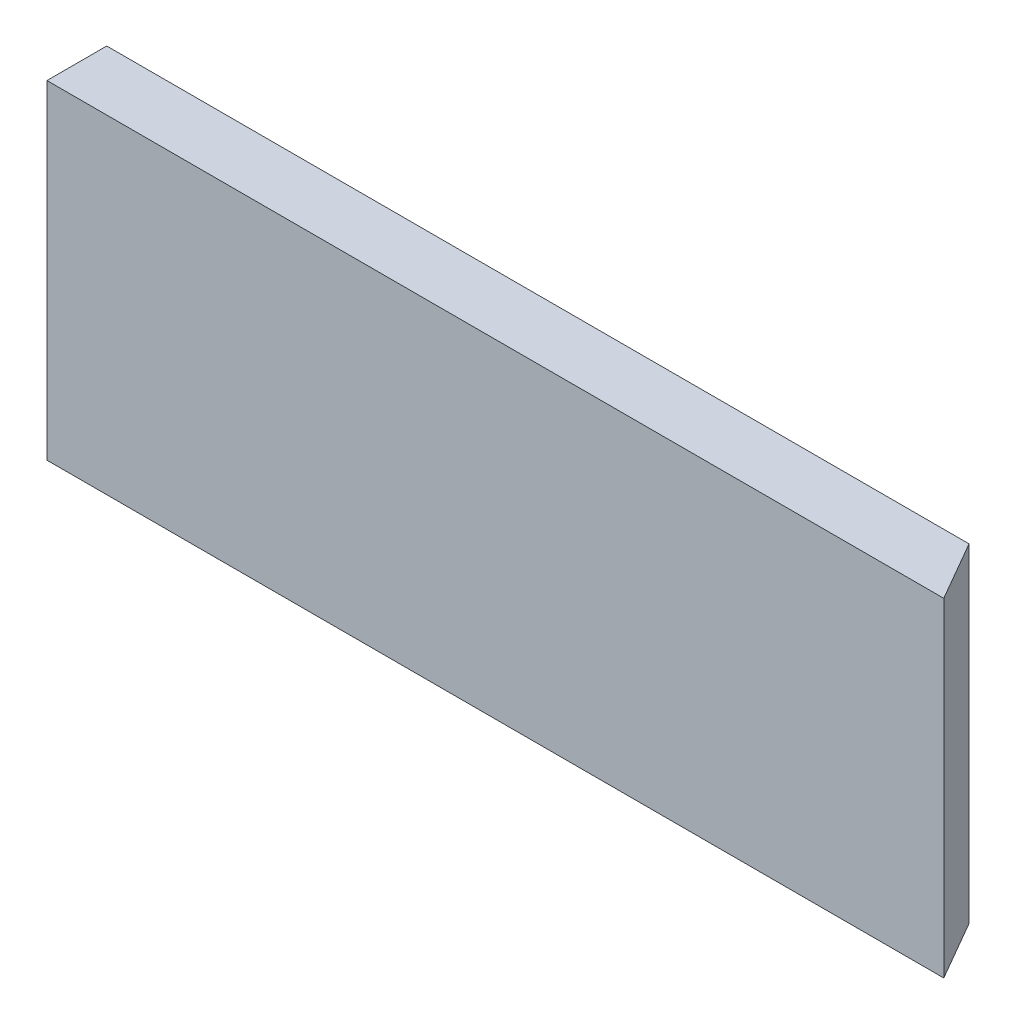
from build123d import *

# Parameters (mm, degrees)
SKETCH1_W           = 95.25
SKETCH1_H           = 34.925
BOSS_EXTRUDE1_DEPTH = 3.175
CUT_EXTRUDE1_REACH  = 61.144


with BuildPart() as part:
    # Sketch1 → Boss-Extrude1 (new, symmetric)
    with BuildSketch(Plane.XY):
        Rectangle(SKETCH1_W, SKETCH1_H)
    extrude(amount=BOSS_EXTRUDE1_DEPTH, both=True)

    # Sketch2 → Cut-Extrude1 (cut, up to next)
    with BuildSketch(Plane(origin=(0, 17.4625, 0), x_dir=(1, 0, 0), z_dir=(0, 1, 0)), mode=Mode.PRIVATE) as cut_extrude1_sk1:
        Polygon((47.625, -3.175), (43.958825791, 3.175), (47.625, 3.175), align=None)
    cut_extrude1_tool1 = extrude(cut_extrude1_sk1.sketch, amount=-CUT_EXTRUDE1_REACH, mode=Mode.PRIVATE) & part.part
    add(cut_extrude1_tool1.solids().sort_by_distance((46.402942, 17.4625, -1.058333))[0], mode=Mode.SUBTRACT)


solid = part.part
